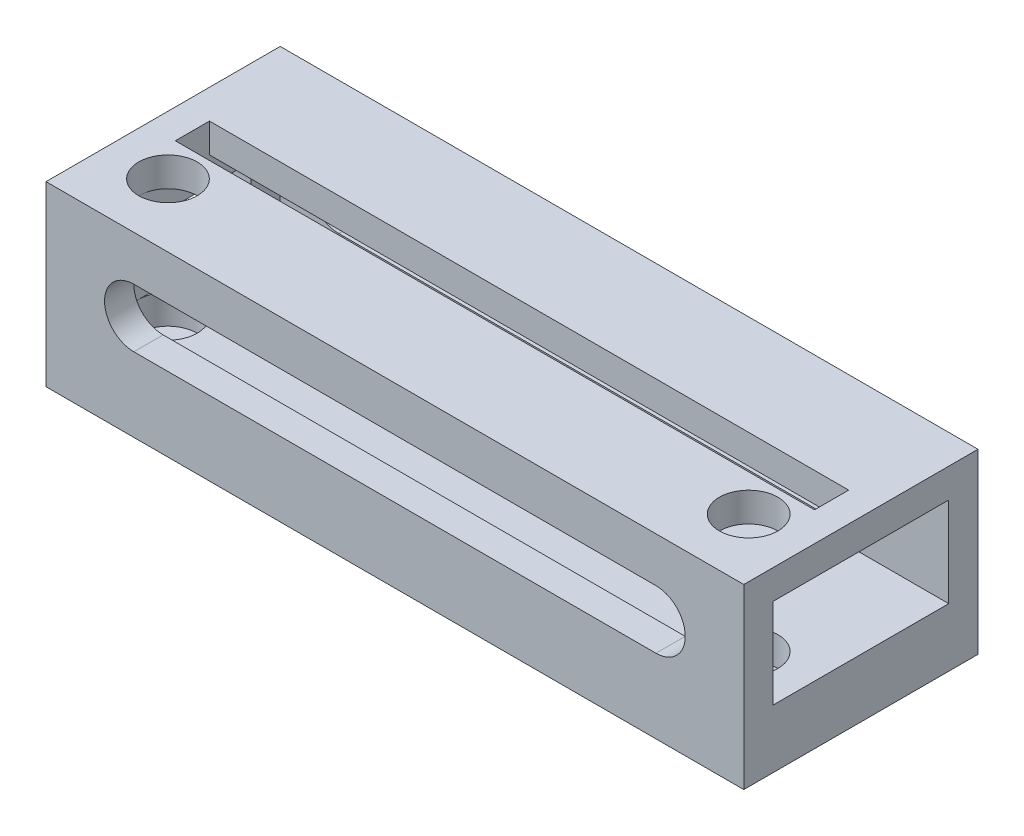
from build123d import *

# Parameters (mm, degrees)
SKETCH1_W              = 65.5
SKETCH1_H              = 9
SKETCH1_R              = 0.998395378
SKETCH1_R_2            = 1.243115981
BOSS_EXTRUDE1_DEPTH    = 6
SKETCH3_W              = 65.5
SKETCH3_H              = 6
BOSS_EXTRUDE2_DEPTH    = 10
SKETCH4_W              = 65.5
SKETCH4_H              = 6
BOSS_EXTRUDE3_DEPTH    = 2
SKETCH5_W              = 65.5
SKETCH5_H              = 3
BOSS_EXTRUDE4_DEPTH    = 9.2
SKETCH7_W              = 21
SKETCH7_H              = 15.2
BOSS_EXTRUDE6_DEPTH    = 3
SKETCH12_W             = 68.5
SKETCH12_H             = 15.2
BOSS_EXTRUDE10_DEPTH   = 3
SKETCH13_W             = 24
SKETCH13_H             = 15.2
SKETCH13_W_2           = 12
SKETCH13_H_2           = 3.7
BOSS_EXTRUDE11_DEPTH   = 3
CUT_EXTRUDE2_DEPTH     = 46.662922596
SKETCH11_W             = 18
SKETCH11_H             = 9.2
CUT_EXTRUDE4_DEPTH     = 3
SKETCH14_W             = 71.5
SKETCH14_H             = 24
BOSS_EXTRUDE12_DEPTH   = 3
SKETCH15_W             = 65.5
SKETCH15_H             = 3.5
CUT_EXTRUDE5_DEPTH     = 3
SKETCH16_R             = 3
CUT_EXTRUDE6_DEPTH     = 15.2
MIRROR10_OUTLINE_W     = 71.5
MIRROR10_OUTLINE_H     = 24
MIRROR10_OUTLINE_R     = 3
MIRROR10_DEPTH         = 6
MIRROR10_START         = 6
MIRROR10_2_DEPTH       = 12.2
MIRROR10_START_2       = 15.2
MIRROR10_3_OUTLINE_W   = 65.5
MIRROR10_3_OUTLINE_H   = 3.5
MIRROR10_3_OUTLINE_R   = 3
MIRROR10_3_DEPTH       = 3
MIRROR10_4_OUTLINE_R   = 3
MIRROR10_4_OUTLINE_R_2 = 1.243115981
MIRROR10_4_OUTLINE_R_3 = 0.998395378
MIRROR10_4_DEPTH       = 3
MIRROR10_5_OUTLINE_W   = 3
MIRROR10_5_OUTLINE_H   = 12
MIRROR10_5_DEPTH       = 2.75
MIRROR10_START_3       = 12.45
MIRROR10_6_OUTLINE_W   = 3
MIRROR10_6_OUTLINE_H   = 12
MIRROR10_6_DEPTH       = 2.75
MIRROR10_START_4       = -17.5
MIRROR10_7_DEPTH       = 24
SKETCH17_W             = 71.5
SKETCH17_H             = 24
CUT_EXTRUDE7_DEPTH     = 111.181906409


with BuildPart() as part:
    # Sketch1 → Boss-Extrude1 (new body)
    with BuildSketch(Plane(origin=(0, 0, 0), x_dir=(1, 0, 0), z_dir=(0, 1, 0))):
        Rectangle(SKETCH1_W, SKETCH1_H)
        with Locations(Location((-29.75, 0, 0), (0, 0, 270))):
            Circle(SKETCH1_R, mode=Mode.SUBTRACT)
        with Locations(Location((29.75, 0, 0), (0, 0, 270))):
            Circle(SKETCH1_R_2, mode=Mode.SUBTRACT)
    extrude(amount=BOSS_EXTRUDE1_DEPTH)

    # Sketch3 → Boss-Extrude2 (add)
    with BuildSketch(Plane(origin=(0, 0, -4.5), x_dir=(-1, 0, 0), z_dir=(0, 0, -1))):
        with Locations((0, 3)):
            Rectangle(SKETCH3_W, SKETCH3_H)
    extrude(amount=BOSS_EXTRUDE2_DEPTH)

    # Sketch4 → Boss-Extrude3 (add)
    with BuildSketch(Plane.XY.offset(4.5)):
        with Locations((0, 3)):
            Rectangle(SKETCH4_W, SKETCH4_H)
    extrude(amount=BOSS_EXTRUDE3_DEPTH)

    # Sketch5 → Boss-Extrude4 (add)
    with BuildSketch(Plane(origin=(0, 6, 0), x_dir=(1, 0, 0), z_dir=(0, 1, 0))):
        with Locations((0, -5)):
            Rectangle(SKETCH5_W, SKETCH5_H)
    extrude(amount=BOSS_EXTRUDE4_DEPTH)

    # Sketch7 → Boss-Extrude6 (add)
    with BuildSketch(Plane.ZY.offset(32.75)):
        with Locations((-4, 7.6)):
            Rectangle(SKETCH7_W, SKETCH7_H)
    extrude(amount=BOSS_EXTRUDE6_DEPTH)

    # Sketch12 → Boss-Extrude10 (add)
    with BuildSketch(Plane(origin=(0, 0, -14.5), x_dir=(-1, 0, 0), z_dir=(0, 0, -1))):
        with Locations((1.5, 7.6)):
            Rectangle(SKETCH12_W, SKETCH12_H)
    extrude(amount=BOSS_EXTRUDE10_DEPTH)

    # Sketch13 → Boss-Extrude11 (add)
    with BuildSketch(Plane(origin=(32.75, 0, 0), x_dir=(0, 0, -1), z_dir=(1, 0, 0))):
        with Locations((5.5, 7.6)):
            Rectangle(SKETCH13_W, SKETCH13_H)
        with Locations((5.5, 10.6)):
            Rectangle(SKETCH13_W_2, SKETCH13_H_2, mode=Mode.SUBTRACT)
    extrude(amount=BOSS_EXTRUDE11_DEPTH)

    # Sketch6 → Cut-Extrude2 (cut, through all)
    with BuildSketch(Plane.XY.offset(6.5)):
        with BuildLine():
            ThreePointArc((-23.75, 10.6), (-24.628679656, 12.721320344), (-26.75, 13.6))
            Line((-26.75, 13.6), (-26.75, 7.6))
            ThreePointArc((-26.75, 7.6), (-24.628679656, 8.478679656), (-23.75, 10.6))
        make_face()
        with BuildLine():
            Line((-26.75, 7.6), (-26.75, 13.6))
            ThreePointArc((-26.75, 13.6), (-29.75, 10.6), (-26.75, 7.6))
        make_face()
        with BuildLine():
            ThreePointArc((29.75, 10.6), (28.871320344, 12.721320344), (26.75, 13.6))
            Line((26.75, 13.6), (26.75, 7.6))
            ThreePointArc((26.75, 7.6), (28.871320344, 8.478679656), (29.75, 10.6))
        make_face()
        with BuildLine():
            Line((26.75, 7.6), (26.75, 13.6))
            ThreePointArc((26.75, 13.6), (23.75, 10.6), (26.75, 7.6))
        make_face()
        with BuildLine():
            Line((26.75, 13.6), (-26.75, 13.6))
            ThreePointArc((-26.75, 13.6), (-24.628679656, 12.721320344), (-23.75, 10.6))
            ThreePointArc((-23.75, 10.6), (-24.628679656, 8.478679656), (-26.75, 7.6))
            Line((-26.75, 7.6), (26.75, 7.6))
            ThreePointArc((26.75, 7.6), (23.75, 10.6), (26.75, 13.6))
        make_face()
    extrude(amount=-CUT_EXTRUDE2_DEPTH, mode=Mode.SUBTRACT)

    # Sketch11 → Cut-Extrude4 (cut)
    with BuildSketch(Plane.ZY.offset(35.75)):
        with Locations((-5.5, 10.6)):
            Rectangle(SKETCH11_W, SKETCH11_H)
    extrude(amount=-CUT_EXTRUDE4_DEPTH, mode=Mode.SUBTRACT)

    # Sketch14 → Boss-Extrude12 (add)
    with BuildSketch(Plane(origin=(0, 15.2, 0), x_dir=(1, 0, 0), z_dir=(0, 1, 0))):
        with Locations((0, 5.5)):
            Rectangle(SKETCH14_W, SKETCH14_H)
    extrude(amount=BOSS_EXTRUDE12_DEPTH)

    # Sketch15 → Cut-Extrude5 (cut)
    with BuildSketch(Plane(origin=(0, 18.2, 0), x_dir=(1, 0, 0), z_dir=(0, 1, 0))):
        with Locations((0, 5.5)):
            Rectangle(SKETCH15_W, SKETCH15_H)
    extrude(amount=-CUT_EXTRUDE5_DEPTH, mode=Mode.SUBTRACT)

    # Sketch16 → Cut-Extrude6 (cut)
    with BuildSketch(Plane(origin=(0, 18.2, 0), x_dir=(1, 0, 0), z_dir=(0, 1, 0))):
        with Locations(Location((-29.75, 0, 0), (0, 0, 270))):
            Circle(SKETCH16_R)
        with Locations(Location((29.75, 0, 0), (0, 0, 270))):
            Circle(SKETCH16_R)
    extrude(amount=-CUT_EXTRUDE6_DEPTH, mode=Mode.SUBTRACT)

    # Mirror10: read off the stored shape, not the designer's step
    # Mirror10 outline → Mirror10 (add)
    with BuildSketch(Plane(origin=(0, 0, 0), x_dir=(1, 0, 0), z_dir=(0, 1, 0))):
        with Locations((71.5, 5.5)):
            Rectangle(MIRROR10_OUTLINE_W, MIRROR10_OUTLINE_H)
        with Locations((41.75, 0)):
            Circle(MIRROR10_OUTLINE_R, mode=Mode.SUBTRACT)
        with Locations((101.25, 0)):
            Circle(MIRROR10_OUTLINE_R, mode=Mode.SUBTRACT)
    extrude(amount=MIRROR10_DEPTH)

    # Mirror10 2 outline → Mirror10 2 (add)
    with BuildSketch(Plane(origin=(0, 0, 0), x_dir=(1, 0, 0), z_dir=(0, 1, 0)).offset(MIRROR10_START)):
        Polygon((35.75, -0.5), (35.75, -6.5), (107.25, -6.5), (107.25, -3.5), (38.75, -3.5), (38.75, -0.5), align=None)
        Polygon((35.75, 17.5), (35.75, 11.5), (38.75, 11.5), (38.75, 14.5), (107.25, 14.5), (107.25, 17.5), align=None)
    extrude(amount=MIRROR10_2_DEPTH)

    # Mirror10 3 outline → Mirror10 3 (add)
    with BuildSketch(Plane(origin=(0, 0, 0), x_dir=(1, 0, 0), z_dir=(0, 1, 0)).offset(MIRROR10_START_2)):
        Polygon((35.75, 11.5), (35.75, -0.5), (38.75, -0.5), (38.75, -3.5), (107.25, -3.5), (107.25, 14.5), (38.75, 14.5), (38.75, 11.5), align=None)
        with Locations((71.5, 5.5)):
            Rectangle(MIRROR10_3_OUTLINE_W, MIRROR10_3_OUTLINE_H, mode=Mode.SUBTRACT)
        with Locations((41.75, 0)):
            Circle(MIRROR10_3_OUTLINE_R, mode=Mode.SUBTRACT)
        with Locations((101.25, 0)):
            Circle(MIRROR10_3_OUTLINE_R, mode=Mode.SUBTRACT)
    extrude(amount=MIRROR10_3_DEPTH)

    # Mirror10 4 outline → Mirror10 4 (add)
    # profile 1 of 2: a face of its own
    with BuildSketch(Plane(origin=(0, 0, 0), x_dir=(1, 0, 0), z_dir=(0, 1, 0))):
        with Locations((41.75, 0)):
            Circle(MIRROR10_4_OUTLINE_R)
        with Locations((41.75, 0)):
            Circle(MIRROR10_4_OUTLINE_R_2, mode=Mode.SUBTRACT)
    # profile 2 of 2: a face of its own
    with BuildSketch(Plane(origin=(0, 0, 0), x_dir=(1, 0, 0), z_dir=(0, 1, 0))):
        with Locations((101.25, 0)):
            Circle(MIRROR10_4_OUTLINE_R)
        with Locations((101.25, 0)):
            Circle(MIRROR10_4_OUTLINE_R_3, mode=Mode.SUBTRACT)
    extrude(amount=MIRROR10_4_DEPTH)

    # Mirror10 5 outline → Mirror10 5 (add)
    with BuildSketch(Plane(origin=(0, 0, 0), x_dir=(1, 0, 0), z_dir=(0, 1, 0)).offset(MIRROR10_START)):
        with Locations((37.25, 5.5)):
            Rectangle(MIRROR10_5_OUTLINE_W, MIRROR10_5_OUTLINE_H)
    extrude(amount=MIRROR10_5_DEPTH)

    # Mirror10 6 outline → Mirror10 6 (add)
    with BuildSketch(Plane(origin=(0, 0, 0), x_dir=(1, 0, 0), z_dir=(0, 1, 0)).offset(MIRROR10_START_3)):
        with Locations((37.25, 5.5)):
            Rectangle(MIRROR10_6_OUTLINE_W, MIRROR10_6_OUTLINE_H)
    extrude(amount=MIRROR10_6_DEPTH)

    # Mirror10 7 outline → Mirror10 7 (cut)
    with BuildSketch(Plane.XY.offset(MIRROR10_START_4)):
        with BuildLine():
            Line((44.75, 7.6), (98.25, 7.6))
            ThreePointArc((98.25, 7.6), (101.25, 10.6), (98.25, 13.6))
            Line((98.25, 13.6), (44.75, 13.6))
            ThreePointArc((44.75, 13.6), (41.75, 10.6), (44.75, 7.6))
        make_face()
    extrude(amount=MIRROR10_7_DEPTH, mode=Mode.SUBTRACT)

    # Sketch17 → Cut-Extrude7 (cut, through all)
    with BuildSketch(Plane(origin=(0, 18.2, 0), x_dir=(1, 0, 0), z_dir=(0, 1, 0))):
        with Locations((0, 5.5)):
            Rectangle(SKETCH17_W, SKETCH17_H)
    extrude(amount=-CUT_EXTRUDE7_DEPTH, mode=Mode.SUBTRACT)


solid = part.part
